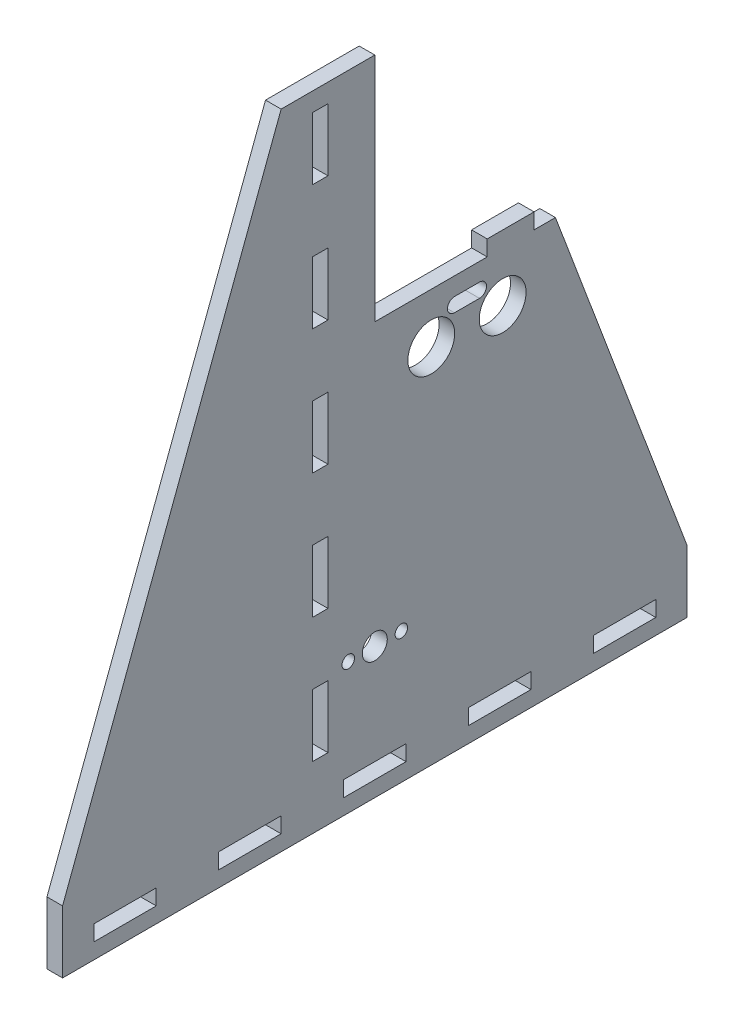
from build123d import *

# Parameters (mm, degrees)
SKICA1_R                = 4
SKICA1_W                = 20
SKICA1_H                = 5
SKICA1_W_2              = 5
SKICA1_H_2              = 20
SKICA1_R_2              = 2
SKICA1_R_3              = 7.5
P_IDAT_VYSUNUT_M1_DEPTH = 5


with BuildPart() as part:
    # Skica1 → Přidat vysunutím1 (new body)
    with BuildSketch(Plane(origin=(0, 0, 0), x_dir=(0, 0, -1), z_dir=(1, 0, 0))):
        Polygon((-100, 0), (100, 0), (100, 20), (57.849462366, 132), (51, 132), (51, 137), (36, 137), (36, 132), (0, 132), (0, 206), (-30, 206), (-100, 20), align=None)
        with Locations((0, 42)):
            Circle(SKICA1_R, mode=Mode.SUBTRACT)
        with Locations((0, 7.5)):
            Rectangle(SKICA1_W, SKICA1_H, mode=Mode.SUBTRACT)
        with Locations((-80, 7.5)):
            Rectangle(SKICA1_W, SKICA1_H, mode=Mode.SUBTRACT)
        with Locations((-40, 7.5)):
            Rectangle(SKICA1_W, SKICA1_H, mode=Mode.SUBTRACT)
        with Locations((-17.5, 30)):
            Rectangle(SKICA1_W_2, SKICA1_H_2, mode=Mode.SUBTRACT)
        with Locations((-8.5, 42)):
            Circle(SKICA1_R_2, mode=Mode.SUBTRACT)
        with Locations((-17.5, 70)):
            Rectangle(SKICA1_W_2, SKICA1_H_2, mode=Mode.SUBTRACT)
        with Locations((-17.5, 110)):
            Rectangle(SKICA1_W_2, SKICA1_H_2, mode=Mode.SUBTRACT)
        with Locations((-17.5, 150)):
            Rectangle(SKICA1_W_2, SKICA1_H_2, mode=Mode.SUBTRACT)
        with Locations((-17.5, 190)):
            Rectangle(SKICA1_W_2, SKICA1_H_2, mode=Mode.SUBTRACT)
        with BuildLine():
            ThreePointArc((33.52225545, 126.25), (35.77225545, 124), (33.52225545, 121.75))
            Line((33.52225545, 121.75), (25.52225545, 121.75))
            ThreePointArc((25.52225545, 121.75), (23.27225545, 124), (25.52225545, 126.25))
            Line((25.52225545, 126.25), (33.52225545, 126.25))
        make_face(mode=Mode.SUBTRACT)
        with Locations((40.95225545, 116)):
            Circle(SKICA1_R_3, mode=Mode.SUBTRACT)
        with Locations((40, 7.5)):
            Rectangle(SKICA1_W, SKICA1_H, mode=Mode.SUBTRACT)
        with Locations((8.5, 42)):
            Circle(SKICA1_R_2, mode=Mode.SUBTRACT)
        with Locations((80, 7.5)):
            Rectangle(SKICA1_W, SKICA1_H, mode=Mode.SUBTRACT)
        with Locations((18.09225545, 116)):
            Circle(SKICA1_R_3, mode=Mode.SUBTRACT)
    extrude(amount=P_IDAT_VYSUNUT_M1_DEPTH)


solid = part.part
